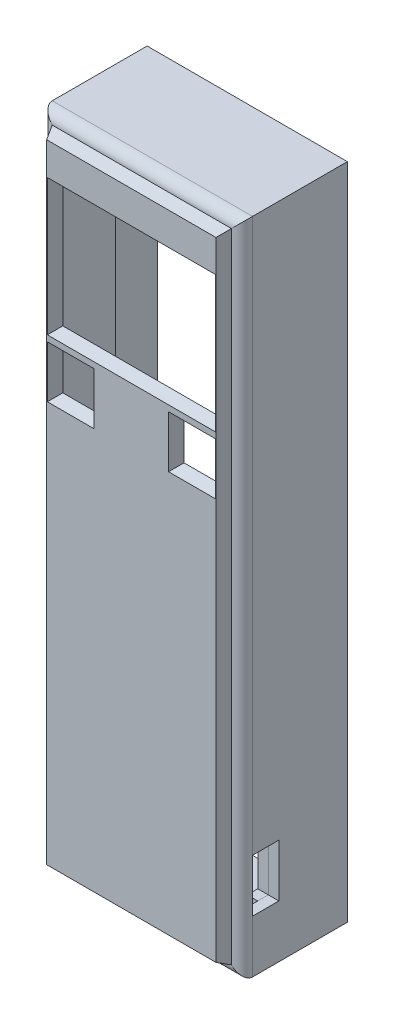
from build123d import *

# Parameters (mm, degrees)
ESBO_O2_W                = 34
ESBO_O2_H                = 121
ESBO_O2_W_2              = 7
ESBO_O2_H_2              = 8
RESSALTO_EXTRUS_O1_DEPTH = 2
RESSALTO_EXTRUS_O1_DRAFT = 25
ESBO_O3_W                = 10
ESBO_O3_H                = 3
RESSALTO_EXTRUS_O2_DEPTH = 5
ESBO_O4_W                = 34
ESBO_O4_H                = 121
ESBO_O4_W_2              = 30
ESBO_O4_H_2              = 117
RESSALTO_EXTRUS_O3_DEPTH = 5
ESBO_O5_W                = 38
ESBO_O5_H                = 125
ESBO_O5_W_2              = 34
ESBO_O5_H_2              = 121
RESSALTO_EXTRUS_O5_DEPTH = 20
FILETE1_R                = 2
ESBO_O6_W                = 5
ESBO_O6_H                = 10
CORTE_EXTRUS_O1_DEPTH    = 66


with BuildPart() as part:
    # Esboço2 → Ressalto-extrusão1 (with draft: the straight prism first)
    with BuildSketch(Plane.XY):
        with Locations((0, 1.5)):
            Rectangle(ESBO_O2_W, ESBO_O2_H)
        with Locations((-11.5, 23)):
            Rectangle(ESBO_O2_W_2, ESBO_O2_H_2, mode=Mode.SUBTRACT)
        with Locations((11.5, 23)):
            Rectangle(ESBO_O2_W_2, ESBO_O2_H_2, mode=Mode.SUBTRACT)
        Polygon((8, 30), (-8, 30), (-15, 30), (-15, 54), (15, 54), (15, 30), align=None, mode=Mode.SUBTRACT)
    extrude(amount=RESSALTO_EXTRUS_O1_DEPTH)
    # Ressalto-extrusão1: the draft: its side faces are tilted about the plane it starts from
    ressalto_extrus_o1_sides = [part.faces().sort_by_distance(p)[0] for p in [
        (0, 62, 1),
        (15, 42, 1),
        (0, 54, 1),
        (-15, 42, 1),
        (0, 30, 1),
        (11.5, 19, 1),
        (15, 23, 1),
        (11.5, 27, 1),
        (8, 23, 1),
        (-15, 23, 1),
        (-11.5, 19, 1),
        (-8, 23, 1),
        (-11.5, 27, 1),
        (0, -59, 1),
        (-17, 1.5, 1),
        (17, 1.5, 1),
    ]]
    draft(ressalto_extrus_o1_sides, Plane.XY, RESSALTO_EXTRUS_O1_DRAFT)

    # Esboço3 → Ressalto-extrusão2 (add)
    with BuildSketch(Plane.XY):
        Polygon((15, -41), (17, -41), (17, 62), (-17, 62), (-17, -41), (-15, -41), (-15, 57), (-15, 60), (-5, 60), (5, 60), (15, 60), (15, 57), align=None)
        with Locations((10, 58.5)):
            Rectangle(ESBO_O3_W, ESBO_O3_H)
        with Locations((-10, 58.5)):
            Rectangle(ESBO_O3_W, ESBO_O3_H)
        Polygon((17, -59), (17, -52), (15, -52), (15, -57), (-15, -57), (-15, -52), (-17, -52), (-17, -59), align=None)
    extrude(amount=-RESSALTO_EXTRUS_O2_DEPTH)

    # Esboço4 → Ressalto-extrusão3 (add)
    with BuildSketch(Plane(origin=(0, 0, -5), x_dir=(-1, 0, 0), z_dir=(0, 0, -1))):
        with Locations((0, 1.5)):
            Rectangle(ESBO_O4_W, ESBO_O4_H)
        with Locations((0, 1.5)):
            Rectangle(ESBO_O4_W_2, ESBO_O4_H_2, mode=Mode.SUBTRACT)
    extrude(amount=RESSALTO_EXTRUS_O3_DEPTH)


with BuildPart() as body_2:
    # Esboço5 → Ressalto-extrusão5 (new body)
    with BuildSketch(Plane.XY):
        with Locations((0, 1.5)):
            Rectangle(ESBO_O5_W, ESBO_O5_H)
        with Locations((0, 1.5)):
            Rectangle(ESBO_O5_W_2, ESBO_O5_H_2, mode=Mode.SUBTRACT)
    extrude(amount=-RESSALTO_EXTRUS_O5_DEPTH)

    # Filete1
    filete1_edges = [body_2.edges().sort_by_distance(p)[0] for p in [
        (-19, 1.5, 0),
        (0, 64, 0),
        (19, 1.5, 0),
        (0, -61, 0),
    ]]
    fillet(filete1_edges, radius=FILETE1_R - 0.0001)  # a hair under: the kernel refuses the full size


with BuildPart() as corte_extrus_o1_tool:
    # Esboço6 → Corte-extrusão1 (new, symmetric)
    with BuildSketch(Plane.ZY.offset(19)):
        with Locations((-4.5, -46)):
            Rectangle(ESBO_O6_W, ESBO_O6_H)
    extrude(amount=CORTE_EXTRUS_O1_DEPTH, both=True)


with BuildPart() as part_1:
    add(part.part)

    # Corte-extrusão1: cut by corte_extrus_o1_tool
    add(corte_extrus_o1_tool.part, mode=Mode.SUBTRACT)


with BuildPart() as body_2_1:
    add(body_2.part)

    # Corte-extrusão1: cut by corte_extrus_o1_tool
    add(corte_extrus_o1_tool.part, mode=Mode.SUBTRACT)


solid = Compound([part_1.part, body_2_1.part])
